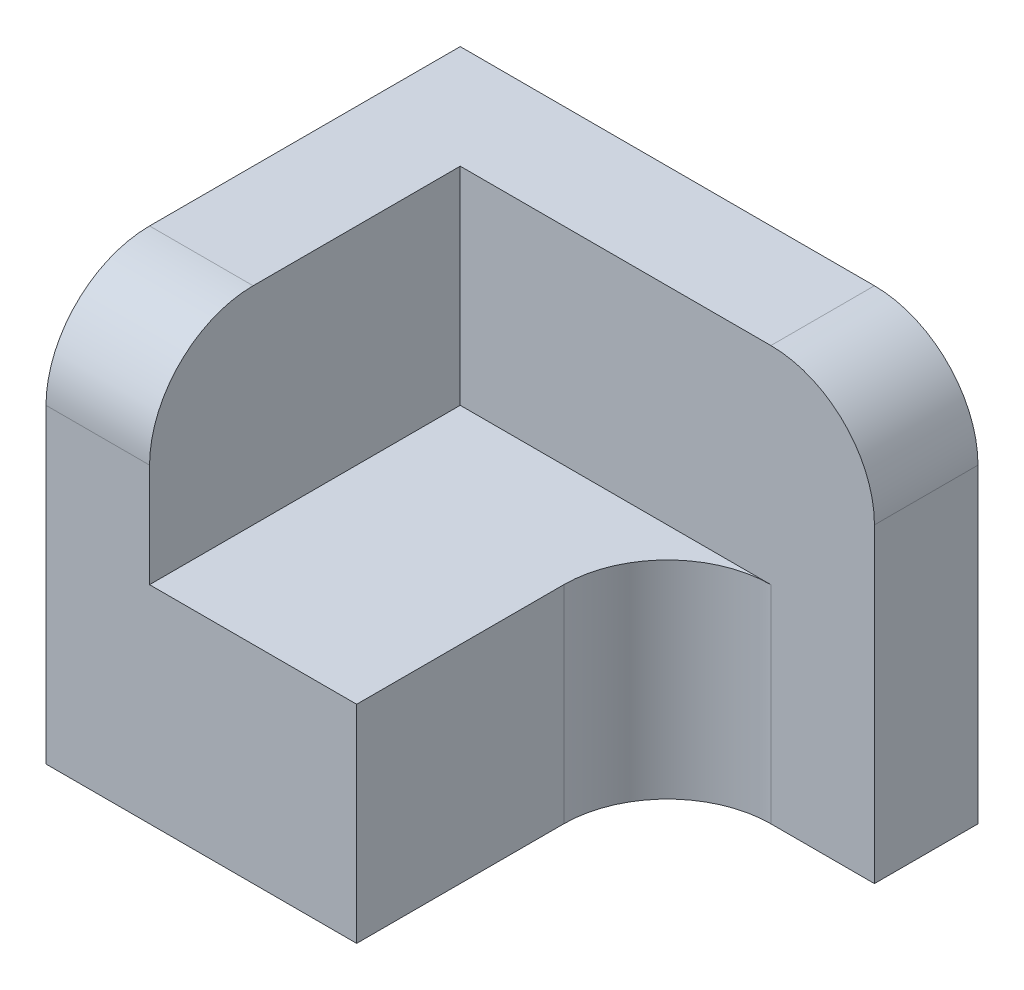
from build123d import *

# Parameters (mm, degrees)
SKETCH_1_W          = 25
SKETCH_1_H          = 20
EXTRUDE_1_DEPTH     = 10
EXTRUDE_2_DEPTH     = 10
SKETCH_3_W          = 10
SKETCH_3_H          = 10
CUT_EXTRUDE_1_DEPTH = 15
FILLET_1_DEPTH      = 10
FILLET_START        = -1
FILLET_1_2_DEPTH    = 6
FILLET_1_3_DEPTH    = 6


with BuildPart() as part:
    # 草圖1 → 填料-伸長1 (new body)
    with BuildSketch(Plane(origin=(0, 0, 0), x_dir=(1, 0, 0), z_dir=(0, 1, 0))):
        with Locations((12.5, -10)):
            Rectangle(SKETCH_1_W, SKETCH_1_H)
    extrude(amount=EXTRUDE_1_DEPTH)

    # 草圖2 → 填料-伸長2 (add)
    with BuildSketch(Plane(origin=(0, 10, 0), x_dir=(1, 0, 0), z_dir=(0, 1, 0))):
        Polygon((0, 0), (0, -20), (5, -20), (5, -5), (25, -5), (25, 0), align=None)
    extrude(amount=EXTRUDE_2_DEPTH)

    # 草圖3 → 除料-伸長1 (cut)
    with BuildSketch(Plane.XY.offset(20)):
        with Locations((20, 5)):
            Rectangle(SKETCH_3_W, SKETCH_3_H)
    extrude(amount=-CUT_EXTRUDE_1_DEPTH, mode=Mode.SUBTRACT)

    # 圓角1: read off the stored shape, not the designer's step
    # 圓角1 outline → 圓角1 (add)
    with BuildSketch(Plane(origin=(0, 0, 0), x_dir=(1, 0, 0), z_dir=(0, 1, 0))):
        with BuildLine():
            ThreePointArc((15, -10), (16.464466094, -6.464466094), (20, -5))
            Line((20, -5), (15, -5))
            Line((15, -5), (15, -10))
        make_face()
    extrude(amount=FILLET_1_DEPTH)

    # Fillet 1 2 outline → Fillet 1 2 (cut)
    with BuildSketch(Plane.YZ.offset(FILLET_START)):
        with BuildLine():
            Line((20, 20), (15, 20))
            ThreePointArc((15, 20), (18.535533906, 18.535533906), (20, 15))
            Line((20, 15), (20, 20))
        make_face()
    extrude(amount=FILLET_1_2_DEPTH, mode=Mode.SUBTRACT)

    # Fillet 1 3 outline → Fillet 1 3 (cut)
    with BuildSketch(Plane.XY.offset(FILLET_START)):
        with BuildLine():
            ThreePointArc((20, 20), (23.535533906, 18.535533906), (25, 15))
            Line((25, 15), (25, 20))
            Line((25, 20), (20, 20))
        make_face()
    extrude(amount=FILLET_1_3_DEPTH, mode=Mode.SUBTRACT)


solid = part.part
